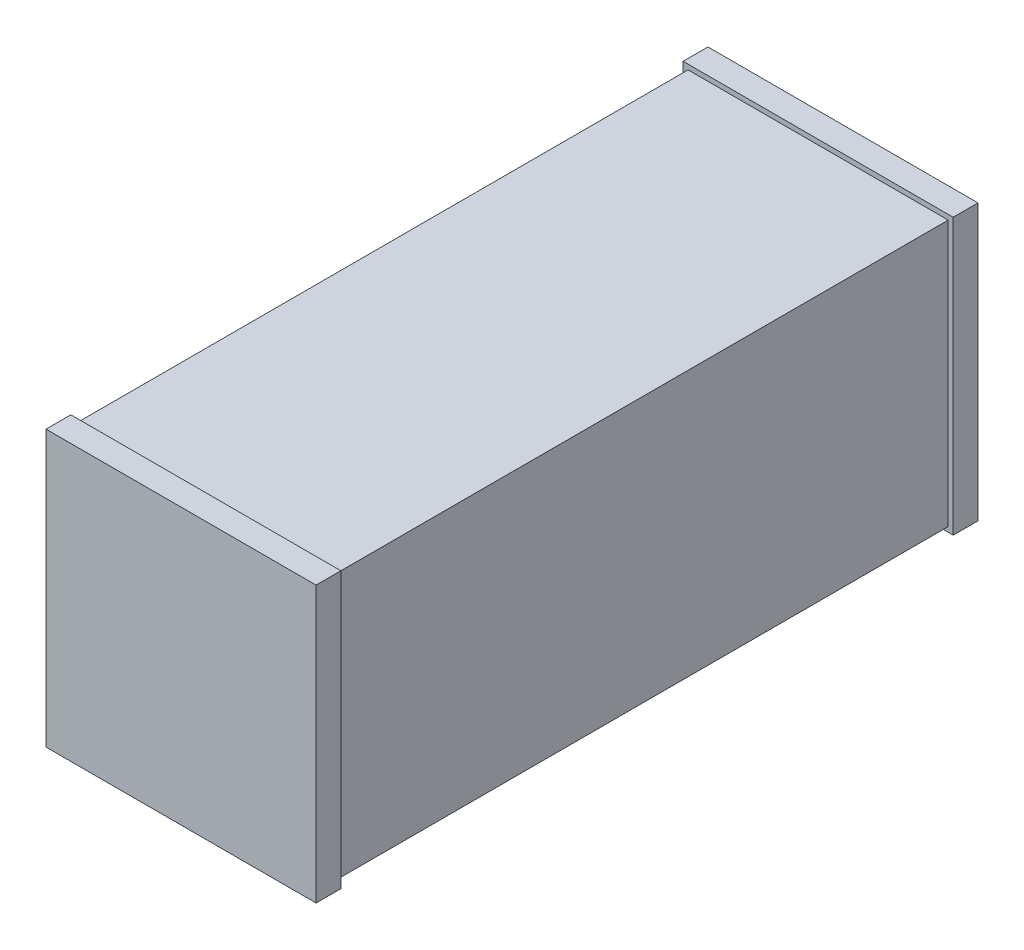
from build123d import *

# Parameters (mm, degrees)
SKETCH1_W                     = 103.632
SKETCH1_H                     = 105.664
BOSS_EXTRUDE1_DEPTH           = 9.525
SKETCH2_W                     = 99.822
SKETCH2_H                     = 101.854
BOSS_EXTRUDE2_DEPTH           = 234.95
SKETCH4_W                     = 103.632
SKETCH4_H                     = 105.664
BOSS_EXTRUDE5_DEPTH           = 9.525
TAP_DRILL_FOR_6_32_TAP1_D     = 2.7051
TAP_DRILL_FOR_6_32_TAP1_DEPTH = 3.97002
TAP_DRILL_FOR_6_32_TAP1_TIP   = 0.81269403


with BuildPart() as part:
    # Sketch1 → Boss-Extrude1 (new body)
    with BuildSketch(Plane.XY):
        with Locations((51.816, -52.832)):
            Rectangle(SKETCH1_W, SKETCH1_H)
    extrude(amount=-BOSS_EXTRUDE1_DEPTH)

    # Sketch2 → Boss-Extrude2 (add)
    with BuildSketch(Plane(origin=(0, 0, -9.525), x_dir=(-1, 0, 0), z_dir=(0, 0, -1))):
        with Locations((-51.816, -52.832)):
            Rectangle(SKETCH2_W, SKETCH2_H)
    extrude(amount=BOSS_EXTRUDE2_DEPTH)

    # Sketch4 → Boss-Extrude5 (add)
    with BuildSketch(Plane(origin=(0, 0, -244.475), x_dir=(-1, 0, 0), z_dir=(0, 0, -1))):
        with Locations((-51.816, -52.832)):
            Rectangle(SKETCH4_W, SKETCH4_H)
    extrude(amount=BOSS_EXTRUDE5_DEPTH)

    # Tap Drill for #6-32 Tap1
    with Locations(Plane(origin=(0, -103.759, 0), x_dir=(-1, 0, 0), z_dir=(0, -1, 0))):
        with Locations((-88.011, 234.95), (-15.621, 234.95), (-88.011, 19.05), (-15.621, 19.05)):
            Hole(TAP_DRILL_FOR_6_32_TAP1_D / 2, depth=TAP_DRILL_FOR_6_32_TAP1_DEPTH)
            with Locations((0, 0, -(TAP_DRILL_FOR_6_32_TAP1_DEPTH + TAP_DRILL_FOR_6_32_TAP1_TIP / 2))):  # 118° drill point
                Cone(0, TAP_DRILL_FOR_6_32_TAP1_D / 2, TAP_DRILL_FOR_6_32_TAP1_TIP, mode=Mode.SUBTRACT)


solid = part.part
